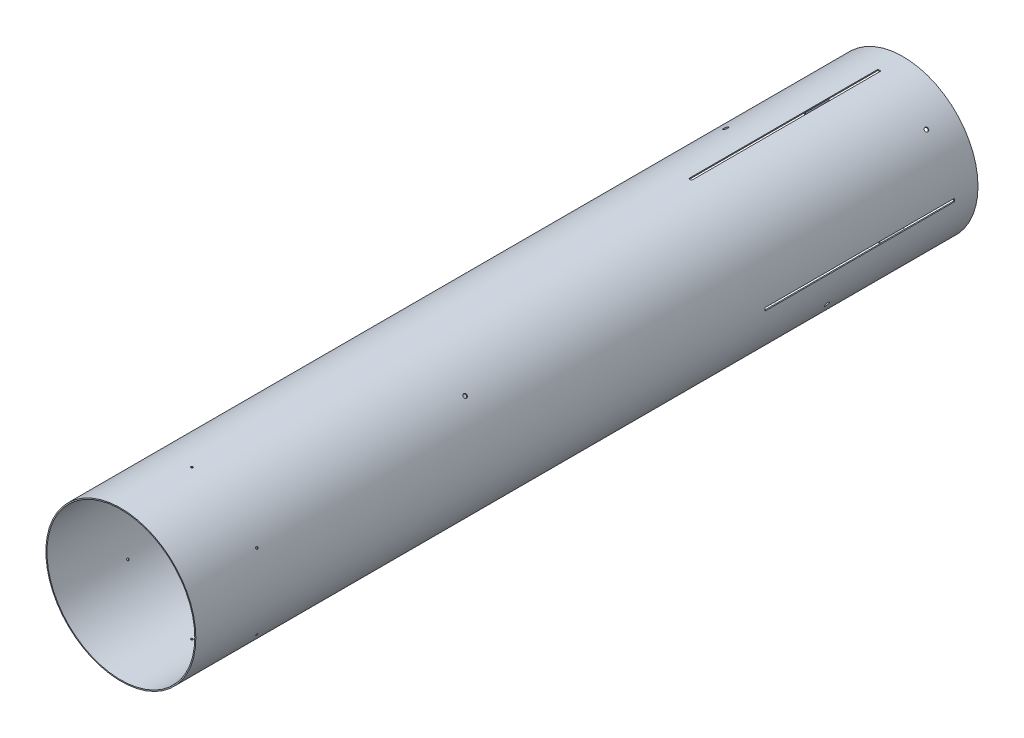
from build123d import *

# Parameters (mm, degrees)
SKETCH2_R                      = 80.518
SKETCH2_R_2                    = 79.375
BOSS_EXTRUDE1_DEPTH            = 839.7875
SKETCH3_W                      = 3.175
SKETCH3_H                      = 203.2
CUT_EXTRUDE1_DEPTH             = 848.472325096
CIRPATTERN1_COUNT              = 2
CIRPATTERN1_ANGLE              = 90
TAP_DRILL_FOR_4_40_TAP1_REACH  = 860.871
TAP_DRILL_FOR_4_40_TAP1_BORE_R = 1.1303
CIRPATTERN2_COUNT              = 6
CUT_EXTRUDE3_REACH             = 718.07
CUT_EXTRUDE3_END_RADIUS        = 79.375
SKETCH10_R                     = 2.54
MIRROR3_START                  = 79.33434949
MIRROR3_OUTLINE_R              = 2.54
MIRROR3_DEPTH                  = 1.183650576
MIRROR3_2_OUTLINE_R            = 2.54
MIRROR3_2_DEPTH                = 1.183650576
CUT_EXTRUDE4_REACH             = 849.472
CUT_EXTRUDE4_END_RADIUS        = 80.518
SKETCH12_R                     = 2.032
LPATTERN1_COUNT                = 2
LPATTERN1_PITCH                = 495.3


# Read off the part's stored shape, not the designer's step: Mirror3
with BuildPart() as part:
    # Sketch2 → Boss-Extrude1 (new body)
    with BuildSketch(Plane.XY):
        Circle(SKETCH2_R)
        Circle(SKETCH2_R_2, mode=Mode.SUBTRACT)
    extrude(amount=BOSS_EXTRUDE1_DEPTH)

    # Sketch3 → Cut-Extrude1 (cut, symmetric)
    with BuildSketch(Plane(origin=(0, 0, 0), x_dir=(1, 0, 0), z_dir=(0, 1, 0))):
        with Locations((0, -127)):
            Rectangle(SKETCH3_W, SKETCH3_H)
    cut_extrude1 = extrude(amount=CUT_EXTRUDE1_DEPTH, both=True, mode=Mode.SUBTRACT)

    # CirPattern1: Cut-Extrude1 ×2 about axis
    cirpattern1_axis = Axis((0, 0, 0), (0, 0, 1))
    for i in range(1, CIRPATTERN1_COUNT):
        add(cut_extrude1.rotate(cirpattern1_axis, i * CIRPATTERN1_ANGLE / (CIRPATTERN1_COUNT - 1)), mode=Mode.SUBTRACT)

    # Tap Drill for #4-40 Tap1 bore → Tap Drill for #4-40 Tap1 (cut, up to next)
    with BuildSketch(Plane(origin=(0, 80.518, 0), x_dir=(1, 0, 0), z_dir=(0, 1, 0)), mode=Mode.PRIVATE) as tap_drill_for_4_40_tap1_sk1:
        with Locations((0, -763.5875)):
            Circle(TAP_DRILL_FOR_4_40_TAP1_BORE_R)
    tap_drill_for_4_40_tap1_tool1 = extrude(tap_drill_for_4_40_tap1_sk1.sketch, amount=-TAP_DRILL_FOR_4_40_TAP1_REACH, mode=Mode.PRIVATE) & part.part
    tap_drill_for_4_40_tap1 = tap_drill_for_4_40_tap1_tool1.solids().sort_by_distance((0, 80.518, 763.5875))[0]
    add(tap_drill_for_4_40_tap1, mode=Mode.SUBTRACT)

    # CirPattern2: Tap Drill for #4-40 Tap1 ×6 about axis
    cirpattern2_axis = Axis((0, 0, 839.7875), (0, 0, 1))
    for i in range(1, CIRPATTERN2_COUNT):
        add(tap_drill_for_4_40_tap1.rotate(cirpattern2_axis, i * 360 / CIRPATTERN2_COUNT), mode=Mode.SUBTRACT)

    # Cut-Extrude3: up to this cylinder (the profile starts outside it)
    cut_extrude3_end = Plane(origin=(0, 0, 152.4), z_dir=(0, 0, -1)) * Cylinder(CUT_EXTRUDE3_END_RADIUS, 1595.89, mode=Mode.PRIVATE)
    # Sketch10 → Cut-Extrude3 (cut, up to the surface)
    with BuildSketch(Plane(origin=(-78.325869889, 42.050780089, 152.4), x_dir=(0, 0, 1), z_dir=(-0.8810559042672347, 0.4730121494801644, 0)), mode=Mode.PRIVATE) as cut_extrude3_sk1:
        with Locations(Location((0, 0, 0), (0, 0, 270))):
            Circle(SKETCH10_R)
    cut_extrude3_tool1 = extrude(cut_extrude3_sk1.sketch, amount=-CUT_EXTRUDE3_REACH, mode=Mode.PRIVATE) - cut_extrude3_end
    cut_extrude3 = cut_extrude3_tool1.solids().sort_by_distance((-78.32587, 42.05078, 152.4))[0]
    add(cut_extrude3, mode=Mode.SUBTRACT)

    # Mirror2: Cut-Extrude3 across plane
    add(cut_extrude3.mirror(Plane(origin=(0, 0, 0), x_dir=(0, 0, 1), z_dir=(-0.7071067811865438, -0.7071067811865512, 0))), mode=Mode.SUBTRACT)

    # Mirror3 outline → Mirror3 (cut)
    with BuildSketch(Plane(origin=(0, 0, 0), x_dir=(0.47301214948017106, 0.8810559042672311, 0), z_dir=(0.8810559042672311, -0.47301214948017106, 0)).offset(MIRROR3_START)):
        with Locations((0, 152.4)):
            Circle(MIRROR3_OUTLINE_R)
    extrude(amount=MIRROR3_DEPTH, mode=Mode.SUBTRACT)

    # Mirror3 2 outline → Mirror3 2 (cut)
    with BuildSketch(Plane(origin=(0, 0, 0), x_dir=(0.8810559042672331, 0.47301214948016707, 0), z_dir=(0.4730121494801671, -0.8810559042672332, 0)).offset(MIRROR3_START)):
        with Locations((0, 152.4)):
            Circle(MIRROR3_2_OUTLINE_R)
    extrude(amount=MIRROR3_2_DEPTH, mode=Mode.SUBTRACT)

    # Cut-Extrude4: up to this cylinder (the profile starts inside it)
    cut_extrude4_end = Plane(origin=(0, 0, 31.75), z_dir=(0, 0, -1)) * Cylinder(CUT_EXTRUDE4_END_RADIUS, 1860.98, mode=Mode.PRIVATE)
    # Sketch12 → Cut-Extrude4 (cut, up to the surface)
    with BuildSketch(Plane(origin=(0, 0, 0), x_dir=(0, 0, 1), z_dir=(-0.7071067811865438, -0.7071067811865512, 0)), mode=Mode.PRIVATE) as cut_extrude4_sk1:
        with Locations(Location((31.75, 0, 0), (0, 0, 270))):
            Circle(SKETCH12_R)
    cut_extrude4_tool1 = extrude(cut_extrude4_sk1.sketch, amount=-CUT_EXTRUDE4_REACH, mode=Mode.PRIVATE) & cut_extrude4_end
    cut_extrude4 = cut_extrude4_tool1.solids().sort_by_distance((0, 0, 31.75))[0]
    add(cut_extrude4, mode=Mode.SUBTRACT)

    # LPattern1: Cut-Extrude4 ×2
    with Locations(*[(0, 0, i * LPATTERN1_PITCH) for i in range(1, LPATTERN1_COUNT)]):
        add(cut_extrude4, mode=Mode.SUBTRACT)


solid = part.part
